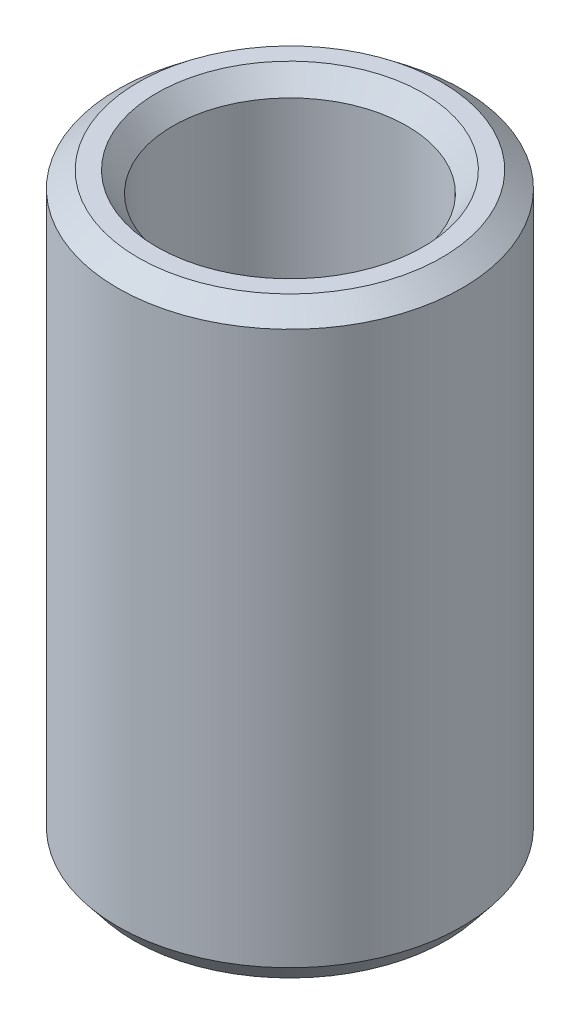
from build123d import *
from OCP.BRepFilletAPI import BRepFilletAPI_MakeChamfer

# Parameters (mm, degrees)
SKETCH1_R           = 40
BOSS_EXTRUDE1_DEPTH = 136.917324424
SKETCH2_R           = 27.182908881
CUT_EXTRUDE1_DEPTH  = 149.143017815
CHAMFER1_SIZE       = 3.772748605
CHAMFER1_SIZE2      = 4.72704176


with BuildPart() as part:
    # Sketch1 → Boss-Extrude1 (new body)
    with BuildSketch(Plane(origin=(0, 0, 0), x_dir=(1, 0, 0), z_dir=(0, 1, 0))):
        Circle(SKETCH1_R)
    extrude(amount=BOSS_EXTRUDE1_DEPTH)

    # Sketch2 → Cut-Extrude1 (cut, through all)
    with BuildSketch(Plane(origin=(0, 0, 0), x_dir=(1, 0, 0), z_dir=(0, 1, 0))):
        Circle(SKETCH2_R)
    extrude(amount=CUT_EXTRUDE1_DEPTH, mode=Mode.SUBTRACT)

    # Chamfer1: one chamfer whose edges measure the first distance from different faces: ONE call of the kernel's chamfer builder (chamfer() names one face for all edges)
    chamfer1_edges_1 = [part.edges().sort_by_distance(p)[0] for p in [
        (-27.182908881, 136.917324424, 0),
    ]]
    chamfer1_side_1 = [part.faces().sort_by_distance(p)[0] for p in [
        (-38.86862915, 136.917324424, 0),
    ]]
    chamfer1_edges_2 = [part.edges().sort_by_distance(p)[0] for p in [
        (-27.182908881, 0, 0),
    ]]
    chamfer1_side_2 = [part.faces().sort_by_distance(p)[0] for p in [
        (-27.182908881, 68.458662212, 0),
    ]]
    chamfer1_edges_3 = [part.edges().sort_by_distance(p)[0] for p in [
        (-40, 0, 0),
    ]]
    chamfer1_side_3 = [part.faces().sort_by_distance(p)[0] for p in [
        (-38.86862915, 0, 0),
    ]]
    chamfer1_edges_4 = [part.edges().sort_by_distance(p)[0] for p in [
        (-40, 136.917324424, 0),
    ]]
    chamfer1_side_4 = [part.faces().sort_by_distance(p)[0] for p in [
        (-40, 68.458662212, 0),
    ]]
    chamfer1 = BRepFilletAPI_MakeChamfer(part.part.solid().wrapped)
    for e in chamfer1_edges_1:
        chamfer1.Add(CHAMFER1_SIZE, CHAMFER1_SIZE2, e.wrapped, chamfer1_side_1[0].wrapped)  # the first distance lies on this face
    for e in chamfer1_edges_2:
        chamfer1.Add(CHAMFER1_SIZE, CHAMFER1_SIZE2, e.wrapped, chamfer1_side_2[0].wrapped)  # the first distance lies on this face
    for e in chamfer1_edges_3:
        chamfer1.Add(CHAMFER1_SIZE, CHAMFER1_SIZE2, e.wrapped, chamfer1_side_3[0].wrapped)  # the first distance lies on this face
    for e in chamfer1_edges_4:
        chamfer1.Add(CHAMFER1_SIZE, CHAMFER1_SIZE2, e.wrapped, chamfer1_side_4[0].wrapped)  # the first distance lies on this face
    add(Compound.cast(chamfer1.Shape()), mode=Mode.REPLACE)


solid = part.part
